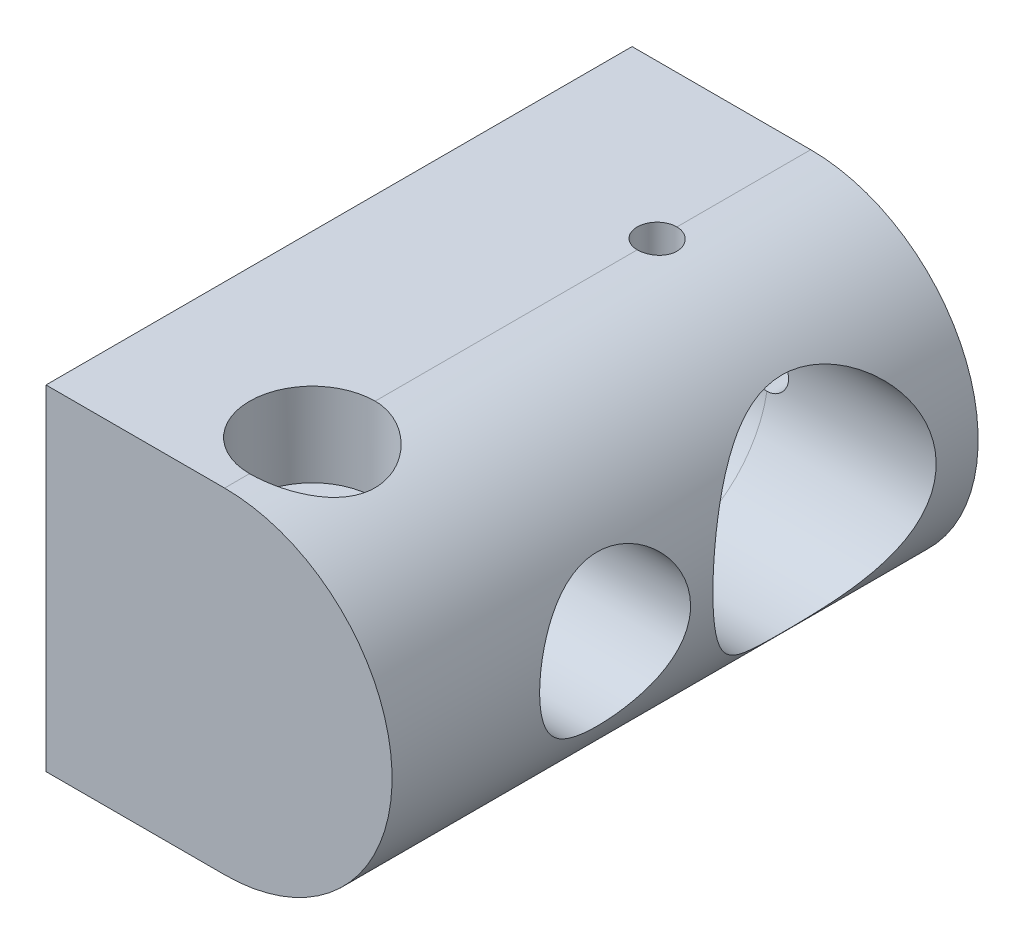
from build123d import *

# Parameters (mm, degrees)
SKETCH1_W              = 9.525
SKETCH1_H              = 33.3375
COMBINE2_START         = -168.91
COMBINE2_OUTLINE_R     = 5.159375
COMBINE2_OUTLINE_R_2   = 4.2926
COMBINE2_DEPTH         = 20.91
COMBINE2_START_2       = -158.802197
COMBINE2_2_OUTLINE_R   = 6.35
COMBINE2_2_OUTLINE_R_2 = 5.159375
COMBINE2_2_DEPTH       = 10.802197
COMBINE2_3_OUTLINE_W   = 19.05
COMBINE2_3_OUTLINE_H   = 33.3375
COMBINE2_3_OUTLINE_R   = 6.35
COMBINE2_3_OUTLINE_R_2 = 4.2926
COMBINE2_3_DEPTH       = 10.107803
COMBINE2_4_OUTLINE_R   = 6.35
COMBINE2_4_OUTLINE_R_2 = 5.159375
COMBINE2_4_DEPTH       = 6.5881249
COMBINE2_START_3       = -11
COMBINE2_5_OUTLINE_R   = 1.7272
COMBINE2_5_OUTLINE_R_2 = 1.1303
COMBINE2_5_DEPTH       = 20.525
COMBINE2_START_4       = 4.7625
COMBINE2_6_OUTLINE_R   = 3.571875
COMBINE2_6_OUTLINE_R_2 = 1.7272
COMBINE2_6_DEPTH       = 4.7625
COMBINE2_7_OUTLINE_R   = 2.1844
COMBINE2_7_OUTLINE_R_2 = 1.7272
COMBINE2_7_DEPTH       = 4.7625


with BuildPart() as part:
    # Sketch1 → Revolve1 (revolve)
    with BuildSketch(Plane(origin=(0, 0, 0), x_dir=(1, 0, 0), z_dir=(0, 1, 0))):
        with Locations((-153.9875, 16.66875)):
            Rectangle(SKETCH1_W, SKETCH1_H)
    revolve(axis=Axis((-158.75, 0, 0), (0, 0, -1)))

    # Combine2: read off the stored shape, not the designer's step
    # Combine2 outline → Combine2 (cut)
    with BuildSketch(Plane.YZ.offset(COMBINE2_START)):
        with Locations((0, -24.5999)):
            Circle(COMBINE2_OUTLINE_R)
        with Locations((0, -12.6873)):
            Circle(COMBINE2_OUTLINE_R_2)
    extrude(amount=COMBINE2_DEPTH, mode=Mode.SUBTRACT)

    # Combine2 2 outline → Combine2 2 (cut)
    with BuildSketch(Plane.YZ.offset(COMBINE2_START_2)):
        with Locations((0, -24.5999)):
            Circle(COMBINE2_2_OUTLINE_R)
        with Locations((0, -24.5999)):
            Circle(COMBINE2_2_OUTLINE_R_2, mode=Mode.SUBTRACT)
    extrude(amount=COMBINE2_2_DEPTH, mode=Mode.SUBTRACT)

    # Combine2 3 outline → Combine2 3 (add)
    with BuildSketch(Plane.YZ.offset(COMBINE2_START)):
        with Locations((0, -16.66875)):
            Rectangle(COMBINE2_3_OUTLINE_W, COMBINE2_3_OUTLINE_H)
        with Locations((0, -24.5999)):
            Circle(COMBINE2_3_OUTLINE_R, mode=Mode.SUBTRACT)
        with Locations((0, -12.6873)):
            Circle(COMBINE2_3_OUTLINE_R_2, mode=Mode.SUBTRACT)
    extrude(amount=COMBINE2_3_DEPTH)

    # Combine2 4 outline → Combine2 4 (add)
    with BuildSketch(Plane.YZ.offset(COMBINE2_START)):
        with Locations((0, -24.5999)):
            Circle(COMBINE2_4_OUTLINE_R)
        with Locations((0, -24.5999)):
            Circle(COMBINE2_4_OUTLINE_R_2, mode=Mode.SUBTRACT)
    extrude(amount=COMBINE2_4_DEPTH)

    # Combine2 5 outline → Combine2 5 (cut)
    with BuildSketch(Plane(origin=(0, 0, 0), x_dir=(1, 0, 0), z_dir=(0, 1, 0)).offset(COMBINE2_START_3)):
        with Locations((-158.75, 4.9911)):
            Circle(COMBINE2_5_OUTLINE_R)
        with Locations((-158.75, 24.5999)):
            Circle(COMBINE2_5_OUTLINE_R_2)
    extrude(amount=COMBINE2_5_DEPTH, mode=Mode.SUBTRACT)

    # Combine2 6 outline → Combine2 6 (cut)
    with BuildSketch(Plane(origin=(0, 0, 0), x_dir=(1, 0, 0), z_dir=(0, 1, 0)).offset(COMBINE2_START_4)):
        with Locations((-158.75, 4.9911)):
            Circle(COMBINE2_6_OUTLINE_R)
        with Locations((-158.75, 4.9911)):
            Circle(COMBINE2_6_OUTLINE_R_2, mode=Mode.SUBTRACT)
    extrude(amount=COMBINE2_6_DEPTH, mode=Mode.SUBTRACT)

    # Combine2 7 outline → Combine2 7 (cut)
    with BuildSketch(Plane(origin=(0, 0, 0), x_dir=(1, 0, 0), z_dir=(0, 1, 0))):
        with Locations((-158.75, 4.9911)):
            Circle(COMBINE2_7_OUTLINE_R)
        with Locations((-158.75, 4.9911)):
            Circle(COMBINE2_7_OUTLINE_R_2, mode=Mode.SUBTRACT)
    extrude(amount=COMBINE2_7_DEPTH, mode=Mode.SUBTRACT)

    # Combine2 8 outline → Combine2 8 (revolve, cut)
    with BuildSketch(Plane(origin=(-158.75, 0, 0), x_dir=(1, 0, 0), z_dir=(0, -1, 0))):
        with BuildLine():
            Line((0, -18.2499), (0, -33.3375))
            Line((0, -33.3375), (1.1303, -33.3375))
            Line((1.1303, -33.3375), (1.130299842, -30.848493624))
            ThreePointArc((1.130299842, -30.848493624), (6.324597596, -24.032480185), (0, -18.2499))
        make_face()
    revolve(axis=Axis((-158.75, 0, 0), (0, 0, 1)), mode=Mode.SUBTRACT)


solid = part.part
